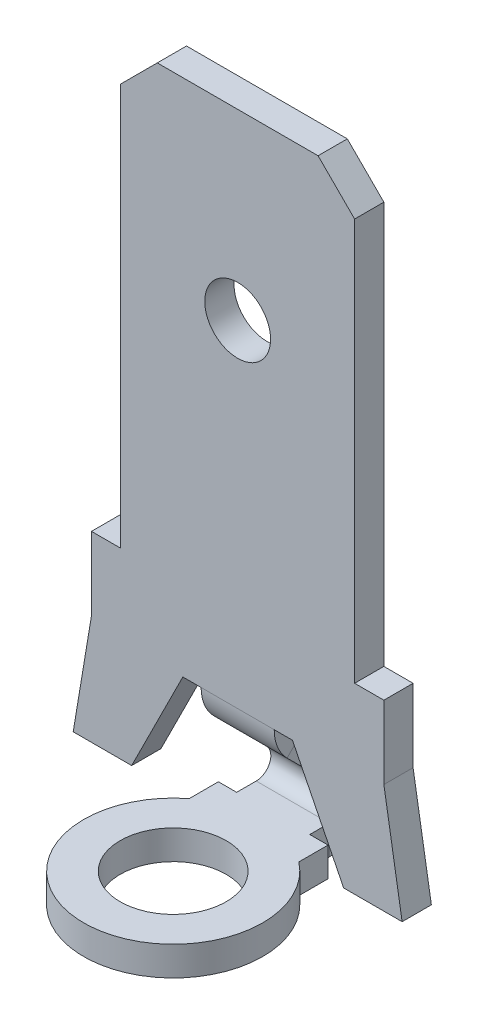
from build123d import *

# Parameters (mm, degrees)
MAINBODYS_W                           = 6.4
MAINBODYS_H                           = 0.8
MAIN_BODY_DEPTH                       = 12
BOTTOM_OF_MAIN_BODY_REACH             = 14.426
BOTTOM_OF_MAIN_BODY_DIRECTION_2_REACH = 14.426
TOPHOLES_R                            = 0.9
TOP_HOLE_DEPTH                        = 13.840950121
F_45_DEGREE_FLANGE_DEPTH              = 2
BOTTOM_FLAT_FLANGE_DEPTH              = 2
EXTENDEDBOTTOMFLANGES_W               = 3
EXTENDEDBOTTOMFLANGES_H               = 0.8
EXTENDED_BOTTOM_FLANGE_DEPTH          = 0.8
BOSSEDCYLINDERBODYS_R                 = 1.45
BOSSED_CYLINDER_BODY_DEPTH            = 0.8
C_MAIN_BODY_SIZE                      = 1


# Sheet-metal steps are written as plain solids
with BuildPart() as part:
    # MainBodyS → MAIN BODY (new body)
    with BuildSketch(Plane(origin=(0, 0, 0), x_dir=(1, 0, 0), z_dir=(0, 1, 0))):
        Rectangle(MAINBODYS_W, MAINBODYS_H)
    extrude(amount=MAIN_BODY_DEPTH)

    # BOTTOM OF MAIN BODY: up to this face of the body (flat: up to its plane)
    bottom_of_main_body_end = Plane(part.part.faces().sort_by_distance((0, 6, 0.4))[0])
    # BottomMainBodyS → BOTTOM OF MAIN BODY (add, up to the picked face)
    with BuildSketch(Plane.XY, mode=Mode.PRIVATE) as bottom_of_main_body_sk1:
        Polygon((0, 0), (4, 0), (4, -2), (4.5, -5), (2.9, -5), (1.5, -2.2), (0, -2.2), align=None)
    bottom_of_main_body_tool1 = split(extrude(bottom_of_main_body_sk1.sketch, amount=BOTTOM_OF_MAIN_BODY_REACH, mode=Mode.PRIVATE), bisect_by=bottom_of_main_body_end, keep=Keep.BOTH, mode=Mode.PRIVATE)
    bottom_of_main_body = bottom_of_main_body_tool1.solids().sort_by(Axis((2.475691, -2.049989, 0), (0, 0, 1)))[0]
    add(bottom_of_main_body)

    # BOTTOM OF MAIN BODY direction 2: up to this face of the body (flat: up to its plane)
    bottom_of_main_body_direction_2_end = Plane(part.part.faces().sort_by_distance((0, 6, -0.4))[0])
    # BottomMainBodyS → BOTTOM OF MAIN BODY direction 2 (add, up to the picked face)
    with BuildSketch(Plane.XY, mode=Mode.PRIVATE) as bottom_of_main_body_direction_2_sk1:
        Polygon((0, 0), (4, 0), (4, -2), (4.5, -5), (2.9, -5), (1.5, -2.2), (0, -2.2), align=None)
    bottom_of_main_body_direction_2_tool1 = split(extrude(bottom_of_main_body_direction_2_sk1.sketch, amount=-BOTTOM_OF_MAIN_BODY_DIRECTION_2_REACH, mode=Mode.PRIVATE), bisect_by=bottom_of_main_body_direction_2_end, keep=Keep.BOTH, mode=Mode.PRIVATE)
    bottom_of_main_body_direction_2 = bottom_of_main_body_direction_2_tool1.solids().sort_by(Axis((2.475691, -2.049989, 0), (0, 0, -1)))[0]
    add(bottom_of_main_body_direction_2)

    # BMB HM: BOTTOM OF MAIN BODY, BOTTOM OF MAIN BODY direction 2 across plane
    add(bottom_of_main_body.mirror(Plane(origin=(0, 0, 0), x_dir=(0, 0, 1), z_dir=(1, 0, 0))))
    add(bottom_of_main_body_direction_2.mirror(Plane(origin=(0, 0, 0), x_dir=(0, 0, 1), z_dir=(1, 0, 0))))

    # TopHoleS → TOP HOLE (cut, through all)
    with BuildSketch(Plane.XY.offset(0.4)):
        with Locations((0, 7)):
            Circle(TOPHOLES_R)
    extrude(amount=-TOP_HOLE_DEPTH, mode=Mode.SUBTRACT)

    # 45 DEGREE FLANGE section (across the edge) → 45 DEGREE FLANGE (add)
    with BuildSketch(Plane(origin=(1, -2.365685425, -0.4), x_dir=(0, 0.7071067811865438, -0.7071067811865512), z_dir=(-1, 0, 0))):
        with BuildLine():
            Line((-0.8, 0.165685425), (-0.8, 2.2))
            Line((-0.8, 2.2), (0, 2.2))
            Line((0, 2.2), (0, 0.165685425))
            ThreePointArc((0, 0.165685425), (0.030448187, 0.012612052), (0.117157288, -0.117157288))
            Line((0.117157288, -0.117157288), (-0.448528137, -0.682842712))
            ThreePointArc((-0.448528137, -0.682842712), (-0.708655439, -0.293534694), (-0.8, 0.165685425))
        make_face()
    extrude(amount=F_45_DEGREE_FLANGE_DEPTH)

    # BOTTOM FLAT FLANGE section (across the edge) → BOTTOM FLAT FLANGE (add)
    with BuildSketch(Plane(origin=(-1, -5.169848481, -2.072792206), x_dir=(0, 1, 0), z_dir=(1, 0, 0))):
        with BuildLine():
            Line((-0.8, 0.965685425), (-0.8, 1.5))
            Line((-0.8, 1.5), (0, 1.5))
            Line((0, 1.5), (0, 0.965685425))
            ThreePointArc((0, 0.965685425), (0.246926627, 0.596133612), (0.682842712, 0.682842712))
            Line((0.682842712, 0.682842712), (1.248528137, 0.117157288))
            ThreePointArc((1.248528137, 0.117157288), (-0.059220119, -0.142970014), (-0.8, 0.965685425))
        make_face()
    extrude(amount=BOTTOM_FLAT_FLANGE_DEPTH)

    # ExtendedBottomFlangeS → EXTENDED BOTTOM FLANGE (add)
    with BuildSketch(Plane.XY.offset(-0.572792206)):
        with Locations((0, -5.569848481)):
            Rectangle(EXTENDEDBOTTOMFLANGES_W, EXTENDEDBOTTOMFLANGES_H)
    extrude(amount=EXTENDED_BOTTOM_FLANGE_DEPTH)

    # BossedCylinderBodyS → BOSSED  CYLINDER BODY (add)
    with BuildSketch(Plane.XZ.offset(5.969848481)):
        with BuildLine():
            Line((-1.5, 0.227207794), (1.5, 0.227207794))
            ThreePointArc((1.5, 0.227207794), (0, 4.614344857), (-1.5, 0.227207794))
        make_face()
        with Locations(Location((0, 2.164344857, 0), (0, 0, 270))):
            Circle(BOSSEDCYLINDERBODYS_R, mode=Mode.SUBTRACT)
    extrude(amount=-BOSSED_CYLINDER_BODY_DEPTH)

    # C MAIN BODY
    c_main_body_edges = [part.edges().sort_by_distance(p)[0] for p in [
        (-3.2, 12, 0),
        (3.2, 12, 0),
    ]]
    chamfer(c_main_body_edges, length=C_MAIN_BODY_SIZE)


solid = part.part
